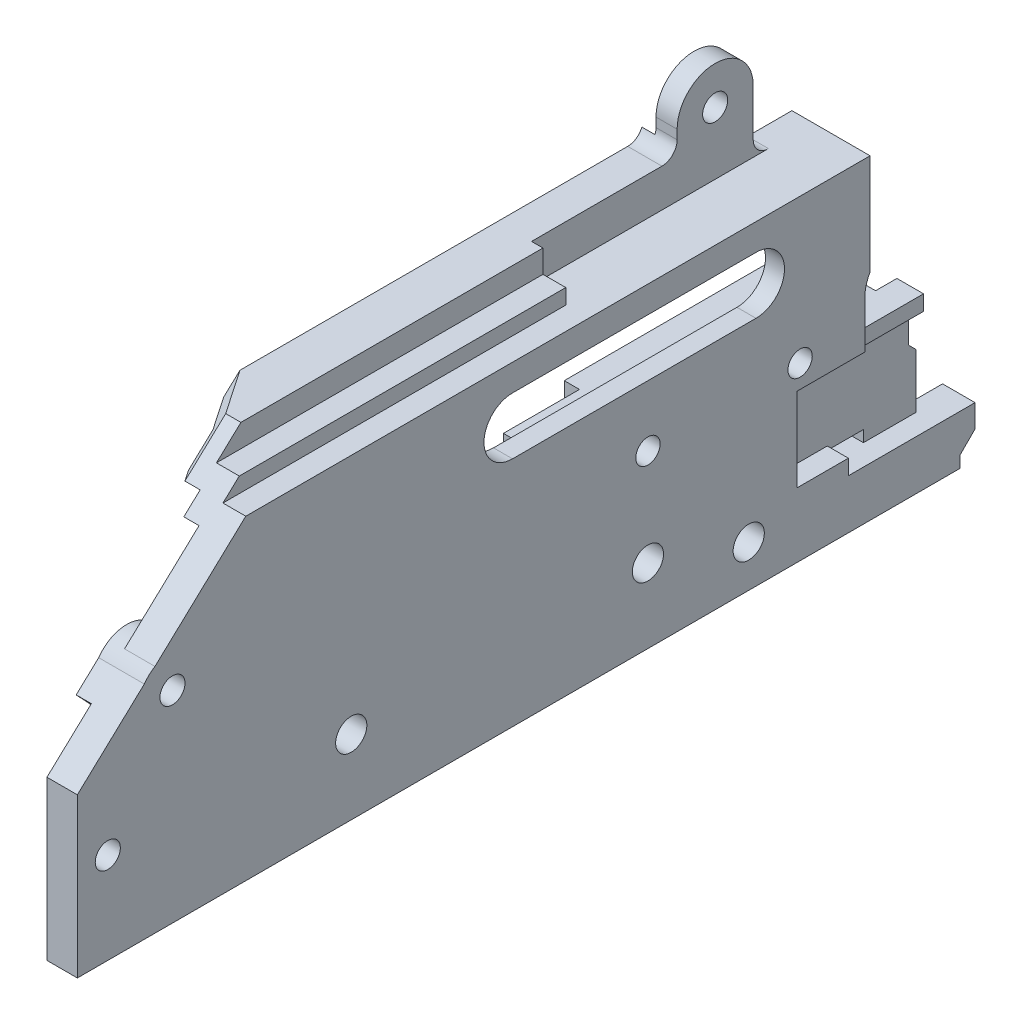
from build123d import *
from build123d.topology import SkipClean

# Parameters (mm, degrees)
SKETCH_1_W                       = 33.2
SKETCH_1_H                       = 22
SKETCH_1_R                       = 1.6
EXTRUDE_1_DEPTH                  = 7
SKETCH_2_W                       = 33.2
SKETCH_2_H                       = 10.5
EXTRUDE_2_DEPTH                  = 2
EXTRUDE_3_DEPTH                  = 60
SKETCH_4_W                       = 2
SKETCH_4_H                       = 10.5
EXTRUDE_4_DEPTH                  = 38.5
SKETCH_5_W                       = 4
SKETCH_5_H                       = 10.5
EXTRUDE_5_DEPTH                  = 2
SKETCH_6_W                       = 4
SKETCH_6_H                       = 10.5
EXTRUDE_6_DEPTH                  = 19.5
SKETCH_7_W                       = 6
SKETCH_7_H                       = 93.2
EXTRUDE_7_DEPTH                  = 2
SKETCH_8_W                       = 93.2
SKETCH_8_H                       = 5
EXTRUDE_8_DEPTH                  = 3
SKETCH_10_W                      = 93.2
SKETCH_10_H                      = 2
EXTRUDE_9_DEPTH                  = 5.5
SKETCH_12_W                      = 18
SKETCH_12_H                      = 2
CUT_EXTRUDE_1_DEPTH              = 5.5
SKETCH_13_W                      = 40
SKETCH_13_H                      = 5
EXTRUDE_10_DEPTH                 = 3.5
CUT_EXTRUDE_2_REACH              = 70.879
SKETCH_15_W                      = 15.5
SKETCH_15_H                      = 5
SKETCH_16_W                      = 3.5
SKETCH_16_H                      = 2.5
EXTRUDE_12_DEPTH                 = 2
CUT_EXTRUDE_3_REACH              = 71.313
CHAMFER_1_SIZE                   = 3.5
SKETCH_18_R                      = 1.65
EXTRUDE_13_DEPTH                 = 2
FILLET_1_R                       = 2
SKETCH_19_W                      = 4.5
SKETCH_19_H                      = 21.5
CUT_EXTRUDE_4_DEPTH              = 5
CHAMFER_2_SIZE                   = 3
CUT_EXTRUDE_5_REACH              = 74.561
SKETCH_20_R                      = 1.65
EXTRUDE_14_REACH                 = 73.895
SKETCH_21_R                      = 4.5
SKETCH_21_R_2                    = 1.65
EXTRUDE_15_DEPTH                 = 6
EXTRUDE_16_DEPTH                 = 4
CUT_EXTRUDE_6_REACH              = 83.84
SKETCH_24_R                      = 1.65
CUT_EXTRUDE_7_REACH              = 84.171
SKETCH_26_W                      = 2
SKETCH_26_H                      = 10.5
CUT_EXTRUDE_8_DEPTH              = 5
SKETCH_27_W                      = 2
SKETCH_27_H                      = 2
EXTRUDE_17_DEPTH                 = 10
CUT_EXTRUDE_9_DEPTH              = 2
CUT_EXTRUDE_10_REACH             = 84.426
SKETCH_29_R                      = 5.5
SKETCH_30_W                      = 63
SKETCH_30_H                      = 2
EXTRUDE_18_DEPTH                 = 1
SKETCH_32_R                      = 1.65
EXTRUDE_19_DEPTH                 = 0.775
EXTRUDE_20_DEPTH                 = 5.5
SKETCH_35_W                      = 5
SKETCH_35_H                      = 10
CUT_EXTRUDE_12_DEPTH             = 1.225
SKETCH_36_W                      = 4
SKETCH_36_H                      = 10
EXTRUDE_21_DEPTH                 = 5
CUT_EXTRUDE_13_REACH             = 84.197
SKETCH_37_W                      = 4.75
SKETCH_37_H                      = 3
CUT_EXTRUDE_13_DIRECTION_2_REACH = 84.197
CUT_EXTRUDE_14_REACH             = 84.197
SKETCH_38_W                      = 14.6
SKETCH_38_H                      = 11
CUT_EXTRUDE_14_DIRECTION_2_DEPTH = 1
SKETCH_39_W                      = 1.5
SKETCH_39_H                      = 20
EXTRUDE_22_DEPTH                 = 5.8
EXTRUDE_22_DIRECTION_2_REACH     = 116.063
SKETCH_40_W                      = 1.5
SKETCH_40_H                      = 10
EXTRUDE_23_DEPTH                 = 5
CUT_EXTRUDE_15_REACH             = 84.085
SKETCH_41_W                      = 1
SKETCH_41_H                      = 7
CHAMFER_3_SIZE                   = 1
SKETCH_42_W                      = 2.775
SKETCH_42_H                      = 5
EXTRUDE_24_DEPTH                 = 10.8
CUT_EXTRUDE_16_REACH             = 84.085
SKETCH_43_W                      = 0.6
SKETCH_43_H                      = 2
SKETCH_44_W                      = 9.8
SKETCH_44_H                      = 2
EXTRUDE_25_DEPTH                 = 2
SKETCH_45_W                      = 0.8
SKETCH_45_H                      = 6.1
CUT_EXTRUDE_17_DEPTH             = 0.775
CUT_EXTRUDE_18_REACH             = 84.426
SKETCH_46_R                      = 2.05
CUT_EXTRUDE_19_DEPTH             = 1
SKETCH_48_R                      = 2.05
CUT_EXTRUDE_20_DEPTH             = 5
CUT_EXTRUDE_21_REACH             = 113.959
SKETCH_50_W                      = 0.5
SKETCH_50_H                      = 17.5
CUT_EXTRUDE_22_DEPTH             = 3
EXTRUDE_26_DEPTH                 = 14.5
EXTRUDE_27_DEPTH                 = 0.5
SKETCH_54_W                      = 28.68337521
SKETCH_54_H                      = 12.5
SKETCH_54_W_2                    = 11.341687605
CUT_EXTRUDE_23_DEPTH             = 3
EXTRUDE_28_REACH                 = 83.879
FILLET_2_R                       = 0.8
EXTRUDE_START                    = -3.5
SKETCH_56_R                      = 4
SKETCH_56_R_2                    = 2.05
EXTRUDE_29_DEPTH                 = 3.5
FILLET_3_R                       = 0.8
CUT_EXTRUDE_24_REACH             = 83.879
SKETCH_57_R                      = 2.05
SKETCH_58_W                      = 15.2
SKETCH_58_H                      = 8.5
CUT_EXTRUDE_25_DEPTH             = 3.5
FILLET_4_R                       = 0.8
EXTRUDE_START_2                  = 0.5
SKETCH_31_W                      = 76.7
SKETCH_31_H                      = 10.5
EXTRUDE_30_DEPTH                 = 0.5
CUT_EXTRUDE_26_REACH             = 83.939
SKETCH_59_W                      = 2.6
SKETCH_59_H                      = 10
CUT_EXTRUDE_27_REACH             = 83.939
EXTRUDE_31_DEPTH                 = 1.5
SKETCH_62_W                      = 2.775
SKETCH_62_H                      = 2
EXTRUDE_32_DEPTH                 = 1.5
EXTRUDE_33_DEPTH                 = 1.5
SKETCH_64_W                      = 4.275
SKETCH_64_H                      = 5
EXTRUDE_34_DEPTH                 = 5
CHAMFER_4_SIZE                   = 2
EXTRUDE_START_3                  = 1.5
SKETCH_65_R                      = 2.05
EXTRUDE_35_DEPTH                 = 1.5
CUT_EXTRUDE_28_DEPTH             = 1
SKETCH_67_W                      = 1.5
SKETCH_67_H                      = 1.5
EXTRUDE_36_DEPTH                 = 1.5
CUT_EXTRUDE_29_REACH             = 76.844
EXTRUDE_37_REACH                 = 74.163
CUT_EXTRUDE_30_DEPTH             = 10
EXTRUDE_38_DEPTH                 = 0.5
CUT_EXTRUDE_31_DEPTH             = 2.932558371


# Some blends are built 0.0001 mm under size
with BuildPart() as part:
    # 草图1 → 凸台-拉伸1 (new body)
    with BuildSketch(Plane(origin=(0, 0, 0), x_dir=(0, 0, -1), z_dir=(1, 0, 0))):
        with Locations((12.6, -4.5)):
            Rectangle(SKETCH_1_W, SKETCH_1_H)
        Circle(SKETCH_1_R, mode=Mode.SUBTRACT)
        with Locations((20, 0)):
            Circle(SKETCH_1_R, mode=Mode.SUBTRACT)
    extrude(amount=EXTRUDE_1_DEPTH)

    # 草图2 → 凸台-拉伸2 (add)
    with BuildSketch(Plane(origin=(7, 0, 0), x_dir=(0, 0, -1), z_dir=(1, 0, 0))):
        with Locations((12.6, 11.75)):
            Rectangle(SKETCH_2_W, SKETCH_2_H)
    extrude(amount=-EXTRUDE_2_DEPTH)

    # 草图3 → 凸台-拉伸3 (add)
    with BuildSketch(Plane.XY.offset(4)):
        Polygon((7, -15.5), (1, -15.5), (1, 4.5), (3, 4.5), (3, 6.5), (7, 6.5), align=None)
    extrude(amount=EXTRUDE_3_DEPTH)

    # 草图4 → 凸台-拉伸4 (add)
    with BuildSketch(Plane.XY.offset(4)):
        with Locations((6, 11.75)):
            Rectangle(SKETCH_4_W, SKETCH_4_H)
    extrude(amount=EXTRUDE_4_DEPTH)

    # 草图5 → 凸台-拉伸5 (add)
    with BuildSketch(Plane.XY.offset(42.5)):
        with Locations((5, 11.75)):
            Rectangle(SKETCH_5_W, SKETCH_5_H)
    extrude(amount=EXTRUDE_5_DEPTH)

    # 草图6 → 凸台-拉伸6 (add)
    with BuildSketch(Plane.XY.offset(44.5)):
        with Locations((5, 11.75)):
            Rectangle(SKETCH_6_W, SKETCH_6_H)
    extrude(amount=EXTRUDE_6_DEPTH)

    # 草图7 → 凸台-拉伸7 (add)
    with BuildSketch(Plane(origin=(0, 17, 0), x_dir=(1, 0, 0), z_dir=(0, 1, 0))):
        with Locations((4, -17.4)):
            Rectangle(SKETCH_7_W, SKETCH_7_H)
    extrude(amount=EXTRUDE_7_DEPTH)

    # 草图8 → 凸台-拉伸8 (add)
    with BuildSketch(Plane.ZY.offset(-1)):
        with Locations((17.4, 21.5)):
            Rectangle(SKETCH_8_W, SKETCH_8_H)
    extrude(amount=-EXTRUDE_8_DEPTH)

    # 草图10 → 凸台-拉伸9 (add)
    with BuildSketch(Plane.ZY.offset(-1)):
        with Locations((17.4, 23)):
            Rectangle(SKETCH_10_W, SKETCH_10_H)
    extrude(amount=EXTRUDE_9_DEPTH)

    # 草图12 → 切除-拉伸1 (cut)
    with BuildSketch(Plane.ZY.offset(4.5)):
        with Locations((-20.2, 23)):
            Rectangle(SKETCH_12_W, SKETCH_12_H)
    extrude(amount=-CUT_EXTRUDE_1_DEPTH, mode=Mode.SUBTRACT)

    # 草图13 → 凸台-拉伸10 (add)
    with BuildSketch(Plane.ZY.offset(-1)):
        with Locations((-9.2, 19.5)):
            Rectangle(SKETCH_13_W, SKETCH_13_H)
    extrude(amount=EXTRUDE_10_DEPTH)

    # 草图15 → 切除-拉伸2 (cut, up to next)
    with BuildSketch(Plane(origin=(4, 0, 0), x_dir=(0, 0, -1), z_dir=(1, 0, 0)), mode=Mode.PRIVATE) as cut_extrude_2_sk1:
        with Locations((21.45, 21.5)):
            Rectangle(SKETCH_15_W, SKETCH_15_H)
    cut_extrude_2_tool1 = extrude(cut_extrude_2_sk1.sketch, amount=-CUT_EXTRUDE_2_REACH, mode=Mode.PRIVATE) & part.part
    add(cut_extrude_2_tool1.solids().sort_by_distance((4, 21.5, -21.45))[0], mode=Mode.SUBTRACT)

    # 草图16 → 凸台-拉伸12 (add)
    with BuildSketch(Plane(origin=(0, 22, 0), x_dir=(1, 0, 0), z_dir=(0, 1, 0))):
        with Locations((-0.75, 12.45)):
            Rectangle(SKETCH_16_W, SKETCH_16_H)
    extrude(amount=EXTRUDE_12_DEPTH)

    # 草图17 → 切除-拉伸3 (cut, up to next)
    with BuildSketch(Plane(origin=(7, 0, 0), x_dir=(0, 0, -1), z_dir=(1, 0, 0)), mode=Mode.PRIVATE) as cut_extrude_3_sk1:
        Polygon((-47.5, 24), (-64, 8.613501079), (-64, 24), align=None)
    cut_extrude_3_tool1 = extrude(cut_extrude_3_sk1.sketch, amount=-CUT_EXTRUDE_3_REACH, mode=Mode.PRIVATE) & part.part
    add(cut_extrude_3_tool1.solids().sort_by_distance((7, 18.871167, 58.5))[0], mode=Mode.SUBTRACT)

    # 倒角1
    # the kernel refuses this chamfer: 3.5 mm, written as the material it takes off along each edge
    with BuildSketch(Plane(origin=(-4.5, 15.861407469, 56.227571974), x_dir=(0.9996219169112969, 0.020109211138415985, 0.018752142756900524), z_dir=(0, 0.6819983600625026, -0.7313537016191667))) as chamfer_1_piece_1:
        Polygon((CHAMFER_1_SIZE * 0.999621916911, CHAMFER_1_SIZE * 0.0274958766106), (-CHAMFER_1_SIZE * 0.0274958766106, CHAMFER_1_SIZE * 0.999621916911), (0, 0), align=None)
    extrude(amount=20.934339287, mode=Mode.SUBTRACT)

    # 草图18 → 凸台-拉伸13 (add)
    with BuildSketch(Plane.ZY.offset(2.5)):
        with BuildLine():
            Line((-11.337, 27.2), (-11.337, 24))
            Line((-11.337, 24), (-13.7, 24))
            Line((-13.7, 24), (-13.7, 19))
            Line((-13.7, 19), (-21.337, 19))
            Line((-21.337, 19), (-21.337, 27.2))
            ThreePointArc((-21.337, 27.2), (-16.337, 32.2), (-11.337, 27.2))
        make_face()
        with Locations((-16.337, 27.2)):
            Circle(SKETCH_18_R, mode=Mode.SUBTRACT)
    extrude(amount=-EXTRUDE_13_DEPTH)

    # 圆角1
    fillet_1_edges = [part.edges().sort_by_distance(p)[0] for p in [
        (-1.5, 24, -11.337),
        (-1.5, 19, -21.337),
    ]]
    fillet(fillet_1_edges, radius=FILLET_1_R)

    # 草图19 → 切除-拉伸4 (cut)
    with BuildSketch(Plane(origin=(0, 24, 0), x_dir=(1, 0, 0), z_dir=(0, 1, 0))):
        with Locations((1.75, 2.95)):
            Rectangle(SKETCH_19_W, SKETCH_19_H)
    extrude(amount=-CUT_EXTRUDE_4_DEPTH, mode=Mode.SUBTRACT)

    # 倒角2
    chamfer_2_edges = [part.edges().sort_by_distance(p)[0] for p in [
        (4, 24, 27.65),
        (1, 22, 30.22236871),
    ]]
    chamfer(chamfer_2_edges, length=CHAMFER_2_SIZE)

    # 草图20 → 切除-拉伸5 (cut, up to next)
    with BuildSketch(Plane(origin=(7, 0, 0), x_dir=(0, 0, -1), z_dir=(1, 0, 0)), mode=Mode.PRIVATE) as cut_extrude_5_sk1:
        with Locations((-62.5, 4)):
            Circle(SKETCH_20_R)
    cut_extrude_5_tool1 = extrude(cut_extrude_5_sk1.sketch, amount=-CUT_EXTRUDE_5_REACH, mode=Mode.PRIVATE) & part.part
    add(cut_extrude_5_tool1.solids().sort_by_distance((7, 4, 62.5))[0], mode=Mode.SUBTRACT)

    # 凸台-拉伸14: up to this face of the body (flat: up to its plane)
    extrude_14_end = Plane(part.part.faces().sort_by_distance((7, 1.498387626, 16.627822956))[0])
    # 草图21 → 凸台-拉伸14 (add, up to the picked face)
    with BuildSketch(Plane.ZY.offset(-1), mode=Mode.PRIVATE) as extrude_14_sk1:
        with Locations((62.5, 4)):
            Circle(SKETCH_21_R)
        with Locations(Location((62.5, 4, 0), (0, 0, 180))):
            Circle(SKETCH_21_R_2, mode=Mode.SUBTRACT)
    extrude_14_tool1 = split(extrude(extrude_14_sk1.sketch, amount=-EXTRUDE_14_REACH, mode=Mode.PRIVATE), bisect_by=extrude_14_end, keep=Keep.BOTH, mode=Mode.PRIVATE)
    add(extrude_14_tool1.solids().sort_by(Axis((1, 4, 58.127279), (1, 0, 0)))[0])

    # 草图22 → 凸台-拉伸15 (add)
    with BuildSketch(Plane.ZY.offset(-1)):
        with BuildLine():
            Line((66.198595209, 6.563277878), (75, -1.644164869))
            Line((75, -1.644164869), (75, -15.5))
            Line((75, -15.5), (64, -15.5))
            Line((64, -15.5), (64, -0.242640687))
            ThreePointArc((64, -0.242640687), (66.782111619, 2.616699568), (66.198595209, 6.563277878))
        make_face()
    extrude(amount=-EXTRUDE_15_DEPTH)

    # 草图23 → 凸台-拉伸16 (add)
    with BuildSketch(Plane(origin=(7, 0, 0), x_dir=(0, 0, -1), z_dir=(1, 0, 0))):
        Polygon((-64, 8.613501079), (-64.799032902, 7.868390843), (-64, 8.242640687), align=None)
    extrude(amount=-EXTRUDE_16_DEPTH)

    # 草图24 → 切除-拉伸6 (cut, up to next)
    with BuildSketch(Plane.ZY.offset(-1), mode=Mode.PRIVATE) as cut_extrude_6_sk1:
        with Locations(Location((71, -10.5, 0), (0, 0, 270))):
            Circle(SKETCH_24_R)
    cut_extrude_6_tool1 = extrude(cut_extrude_6_sk1.sketch, amount=-CUT_EXTRUDE_6_REACH, mode=Mode.PRIVATE) & part.part
    add(cut_extrude_6_tool1.solids().sort_by_distance((1, -10.5, 71))[0], mode=Mode.SUBTRACT)

    # 草图25 → 切除-拉伸7 (cut, up to next)
    with BuildSketch(Plane.ZY.offset(-5), mode=Mode.PRIVATE) as cut_extrude_7_sk1:
        with BuildLine():
            Line((17.8, 8), (-14.2, 8))
            ThreePointArc((-14.2, 8), (-17.95, 11.75), (-14.2, 15.5))
            Line((-14.2, 15.5), (17.8, 15.5))
            ThreePointArc((17.8, 15.5), (21.55, 11.75), (17.8, 8))
        make_face()
    cut_extrude_7_tool1 = extrude(cut_extrude_7_sk1.sketch, amount=-CUT_EXTRUDE_7_REACH, mode=Mode.PRIVATE) & part.part
    add(cut_extrude_7_tool1.solids().sort_by_distance((5, 11.75, 1.8))[0], mode=Mode.SUBTRACT)

    # 草图26 → 切除-拉伸8 (cut)
    with BuildSketch(Plane(origin=(0, 0, 42.5), x_dir=(-1, 0, 0), z_dir=(0, 0, -1))):
        with Locations((-4, 11.75)):
            Rectangle(SKETCH_26_W, SKETCH_26_H)
    extrude(amount=-CUT_EXTRUDE_8_DEPTH, mode=Mode.SUBTRACT)

    # 草图27 → 凸台-拉伸17 (add)
    with BuildSketch(Plane.XY.offset(4)):
        with Locations((2, 5.5)):
            Rectangle(SKETCH_27_W, SKETCH_27_H)
    extrude(amount=EXTRUDE_17_DEPTH)

    # 草图28 → 切除-拉伸9 (cut)
    with BuildSketch(Plane.ZY.offset(-1)):
        Polygon((67, 1.494263267), (67, -15.5), (75, -15.5), (75, -1.644164869), (69.155582564, 3.80584256), align=None)
    extrude(amount=-CUT_EXTRUDE_9_DEPTH, mode=Mode.SUBTRACT)

    # 草图29 → 切除-拉伸10 (cut, up to next)
    with BuildSketch(Plane(origin=(7, 0, 0), x_dir=(0, 0, -1), z_dir=(1, 0, 0)), mode=Mode.PRIVATE) as cut_extrude_10_sk1:
        with Locations((34, 3.1)):
            Circle(SKETCH_29_R)
    cut_extrude_10_tool1 = extrude(cut_extrude_10_sk1.sketch, amount=-CUT_EXTRUDE_10_REACH, mode=Mode.PRIVATE) & part.part
    add(cut_extrude_10_tool1.solids().sort_by_distance((7, 3.1, -34))[0], mode=Mode.SUBTRACT)

    # 草图30 → 凸台-拉伸18 (add)
    with BuildSketch(Plane.ZY.offset(-1)):
        with Locations((35.5, -5.5)):
            Rectangle(SKETCH_30_W, SKETCH_30_H)
    extrude(amount=EXTRUDE_18_DEPTH)

    # 草图32 → 凸台-拉伸19 (add)
    with BuildSketch(Plane.ZY.offset(2.5)):
        with BuildLine():
            Line((-11.2, 22), (-11.2, 25.272517354))
            ThreePointArc((-11.2, 25.272517354), (-11.302451602, 25.62986489), (-11.337, 26))
            Line((-11.337, 26), (-11.337, 27.2))
            ThreePointArc((-11.337, 27.2), (-16.337, 32.2), (-21.337, 27.2))
            Line((-21.337, 27.2), (-21.337, 21))
            ThreePointArc((-21.337, 21), (-21.922786438, 19.585786438), (-23.337, 19))
            Line((-23.337, 19), (-29.2, 19))
            Line((-29.2, 19), (-29.2, 17))
            Line((-29.2, 17), (10.8, 17))
            Line((10.8, 17), (10.8, 22))
            Line((10.8, 22), (-11.2, 22))
        make_face()
        with Locations((-16.337, 27.2)):
            Circle(SKETCH_32_R, mode=Mode.SUBTRACT)
    extrude(amount=EXTRUDE_19_DEPTH)

    # 草图34 → 凸台-拉伸20 (add)
    with BuildSketch(Plane.XZ.offset(15.5)):
        Polygon((3, 75), (3, 67), (1, 67), (1, 4), (0, 4), (0, -29.2), (7, -29.2), (7, 75), align=None)
    extrude(amount=EXTRUDE_20_DEPTH)

    # 草图35 → 切除-拉伸12 (cut)
    with BuildSketch(Plane.ZY):
        with Locations((-26.7, -16)):
            Rectangle(SKETCH_35_W, SKETCH_35_H)
    extrude(amount=-CUT_EXTRUDE_12_DEPTH, mode=Mode.SUBTRACT)

    # 草图36 → 凸台-拉伸21 (add)
    with BuildSketch(Plane(origin=(0, 0, -29.2), x_dir=(-1, 0, 0), z_dir=(0, 0, -1))):
        with Locations((-3.225, -16)):
            Rectangle(SKETCH_36_W, SKETCH_36_H)
    extrude(amount=EXTRUDE_21_DEPTH)

    # 草图37 → 切除-拉伸13 (cut, up to next)
    with BuildSketch(Plane(origin=(5.225, 0, 0), x_dir=(0, 0, -1), z_dir=(1, 0, 0)), mode=Mode.PRIVATE) as cut_extrude_13_sk1:
        with Locations((31.225, -14.5)):
            Rectangle(SKETCH_37_W, SKETCH_37_H)
    cut_extrude_13_tool1 = extrude(cut_extrude_13_sk1.sketch, amount=-CUT_EXTRUDE_13_REACH, mode=Mode.PRIVATE) & part.part
    add(cut_extrude_13_tool1.solids().sort_by_distance((5.225, -14.5, -31.225))[0], mode=Mode.SUBTRACT)

    # 草图37 → 切除-拉伸13 direction 2 (cut, up to next)
    with BuildSketch(Plane(origin=(5.225, 0, 0), x_dir=(0, 0, -1), z_dir=(1, 0, 0)), mode=Mode.PRIVATE) as cut_extrude_13_direction_2_sk1:
        with Locations((31.225, -14.5)):
            Rectangle(SKETCH_37_W, SKETCH_37_H)
    cut_extrude_13_direction_2_tool1 = extrude(cut_extrude_13_direction_2_sk1.sketch, amount=CUT_EXTRUDE_13_DIRECTION_2_REACH, mode=Mode.PRIVATE) & part.part
    add(cut_extrude_13_direction_2_tool1.solids().sort_by_distance((5.225, -14.5, -31.225))[0], mode=Mode.SUBTRACT)

    # 草图38 → 切除-拉伸14 (cut, up to next)
    with BuildSketch(Plane(origin=(5.225, 0, 0), x_dir=(0, 0, -1), z_dir=(1, 0, 0)), mode=Mode.PRIVATE) as cut_extrude_14_sk1:
        with Locations((26.9, -8.5)):
            Rectangle(SKETCH_38_W, SKETCH_38_H)
    cut_extrude_14_tool1 = extrude(cut_extrude_14_sk1.sketch, amount=CUT_EXTRUDE_14_REACH, mode=Mode.PRIVATE) & part.part
    add(cut_extrude_14_tool1.solids().sort_by_distance((5.225, -8.5, -26.9))[0], mode=Mode.SUBTRACT)

    # 草图38 → 切除-拉伸14 direction 2 (cut)
    with BuildSketch(Plane(origin=(5.225, 0, 0), x_dir=(0, 0, -1), z_dir=(1, 0, 0))):
        with Locations((26.9, -8.5)):
            Rectangle(SKETCH_38_W, SKETCH_38_H)
    extrude(amount=-CUT_EXTRUDE_14_DIRECTION_2_DEPTH, mode=Mode.SUBTRACT)

    # 草图39 → 凸台-拉伸22 (add)
    with BuildSketch(Plane(origin=(0, 0, -34.2), x_dir=(-1, 0, 0), z_dir=(0, 0, -1))):
        with Locations((-3.475, -11)):
            Rectangle(SKETCH_39_W, SKETCH_39_H)
    extrude(amount=EXTRUDE_22_DEPTH)

    # 草图39 → 凸台-拉伸22 direction 2 (add, up to next)
    with BuildSketch(Plane(origin=(0, 0, -34.2), x_dir=(-1, 0, 0), z_dir=(0, 0, -1)), mode=Mode.PRIVATE) as extrude_22_direction_2_sk1:
        with Locations((-3.475, -11)):
            Rectangle(SKETCH_39_W, SKETCH_39_H)
    extrude_22_direction_2_tool1 = extrude(extrude_22_direction_2_sk1.sketch, amount=-EXTRUDE_22_DIRECTION_2_REACH, mode=Mode.PRIVATE) - part.part
    add(extrude_22_direction_2_tool1.solids().sort_by_distance((3.475, -11, -34.2))[0])

    # 草图40 → 凸台-拉伸23 (add)
    with BuildSketch(Plane(origin=(0, 0, -29.2), x_dir=(-1, 0, 0), z_dir=(0, 0, -1))):
        with Locations((-1.975, -6)):
            Rectangle(SKETCH_40_W, SKETCH_40_H)
    extrude(amount=EXTRUDE_23_DEPTH)

    # 草图41 → 切除-拉伸15 (cut, up to next)
    with BuildSketch(Plane(origin=(4.225, 0, 0), x_dir=(0, 0, -1), z_dir=(1, 0, 0)), mode=Mode.PRIVATE) as cut_extrude_15_sk1:
        with Locations((39.5, -4.5)):
            Rectangle(SKETCH_41_W, SKETCH_41_H)
    cut_extrude_15_tool1 = extrude(cut_extrude_15_sk1.sketch, amount=-CUT_EXTRUDE_15_REACH, mode=Mode.PRIVATE) & part.part
    add(cut_extrude_15_tool1.solids().sort_by_distance((4.225, -4.5, -39.5))[0], mode=Mode.SUBTRACT)

    # 倒角3
    chamfer_3_edges = [part.edges().sort_by_distance(p)[0] for p in [
        (3.475, -8, -39),
    ]]
    chamfer(chamfer_3_edges, length=CHAMFER_3_SIZE - 0.0001)  # a hair under: the kernel refuses the full size

    # 草图42 → 凸台-拉伸24 (add)
    with BuildSketch(Plane(origin=(0, 0, -29.2), x_dir=(-1, 0, 0), z_dir=(0, 0, -1))):
        with Locations((-5.6125, -18.5)):
            Rectangle(SKETCH_42_W, SKETCH_42_H)
    extrude(amount=EXTRUDE_24_DEPTH)

    # 草图43 → 切除-拉伸16 (cut, up to next)
    with BuildSketch(Plane(origin=(4.225, 0, 0), x_dir=(0, 0, -1), z_dir=(1, 0, 0)), mode=Mode.PRIVATE) as cut_extrude_16_sk1:
        with Locations((33.9, -15)):
            Rectangle(SKETCH_43_W, SKETCH_43_H)
    cut_extrude_16_tool1 = extrude(cut_extrude_16_sk1.sketch, amount=CUT_EXTRUDE_16_REACH, mode=Mode.PRIVATE) & part.part
    add(cut_extrude_16_tool1.solids().sort_by_distance((4.225, -15, -33.9))[0], mode=Mode.SUBTRACT)

    # 草图44 → 凸台-拉伸25 (add)
    with BuildSketch(Plane(origin=(4.225, 0, 0), x_dir=(0, 0, -1), z_dir=(1, 0, 0))):
        with Locations((34.1, -2)):
            Rectangle(SKETCH_44_W, SKETCH_44_H)
    extrude(amount=EXTRUDE_25_DEPTH)

    # 草图45 → 切除-拉伸17 (cut)
    with BuildSketch(Plane(origin=(7, 0, 0), x_dir=(0, 0, -1), z_dir=(1, 0, 0))):
        with Locations((28.9, 0.05)):
            Rectangle(SKETCH_45_W, SKETCH_45_H)
    extrude(amount=-CUT_EXTRUDE_17_DEPTH, mode=Mode.SUBTRACT)

    # 草图46 → 切除-拉伸18 (cut, up to next)
    with BuildSketch(Plane(origin=(7, 0, 0), x_dir=(0, 0, -1), z_dir=(1, 0, 0)), mode=Mode.PRIVATE) as cut_extrude_18_sk1:
        with Locations((13.25, -17)):
            Circle(SKETCH_46_R)
    cut_extrude_18_tool1 = extrude(cut_extrude_18_sk1.sketch, amount=-CUT_EXTRUDE_18_REACH, mode=Mode.PRIVATE) & part.part
    add(cut_extrude_18_tool1.solids().sort_by_distance((7, -17, -13.25))[0], mode=Mode.SUBTRACT)

    # 草图47 → 切除-拉伸19 (cut)
    with BuildSketch(Plane.ZY.offset(-1)):
        with BuildLine():
            Line((62.5, -0.5), (67, -0.5))
            Line((67, -0.5), (67, -4.5))
            Line((67, -4.5), (4, -4.5))
            Line((4, -4.5), (4, 6.5))
            Line((4, 6.5), (14, 6.5))
            Line((14, 6.5), (14, 4.5))
            Line((14, 4.5), (58.027864045, 4.5))
            ThreePointArc((58.027864045, 4.5), (59.145898034, 1), (62.5, -0.5))
        make_face()
    extrude(amount=-CUT_EXTRUDE_19_DEPTH, mode=Mode.SUBTRACT)

    # 草图48 → 切除-拉伸20 (cut)
    with BuildSketch(Plane.XZ.offset(21)):
        with Locations(Location((3.5, 58, 0), (0, 0, 270))):
            Circle(SKETCH_48_R)
        with Locations(Location((3.5, 20, 0), (0, 0, 270))):
            Circle(SKETCH_48_R)
        with Locations(Location((3.5, -18, 0), (0, 0, 270))):
            Circle(SKETCH_48_R)
    extrude(amount=-CUT_EXTRUDE_20_DEPTH, mode=Mode.SUBTRACT)

    # 草图50 → 切除-拉伸21 (cut, up to next)
    with BuildSketch(Plane.XY.offset(67), mode=Mode.PRIVATE) as cut_extrude_21_sk1:
        with Locations((0.25, -12.25)):
            Rectangle(SKETCH_50_W, SKETCH_50_H)
    cut_extrude_21_tool1 = extrude(cut_extrude_21_sk1.sketch, amount=-CUT_EXTRUDE_21_REACH, mode=Mode.PRIVATE) & part.part
    add(cut_extrude_21_tool1.solids().sort_by_distance((0.25, -12.25, 67))[0], mode=Mode.SUBTRACT)

    # 草图51 → 切除-拉伸22 (cut)
    with BuildSketch(Plane(origin=(0, 0, -28.85), x_dir=(-1, 0, 0), z_dir=(0, 0, -1))):
        Polygon((-4.225, -14), (-7, -14), (-7, -16), (-1.225, -16), (-1.225, -13), (-4.225, -13), align=None)
    extrude(amount=-CUT_EXTRUDE_22_DEPTH, mode=Mode.SUBTRACT)

    # 草图52 → 凸台-拉伸26 (add)
    with BuildSketch(Plane.XZ.offset(21)):
        with BuildLine():
            Line((1, 59.658312395), (1, 56.341687605))
            ThreePointArc((1, 56.341687605), (0.5, 58), (1, 59.658312395))
        make_face()
        with BuildLine():
            Line((1, 21.658312395), (1, 18.341687605))
            ThreePointArc((1, 18.341687605), (0.5, 20), (1, 21.658312395))
        make_face()
    extrude(amount=-EXTRUDE_26_DEPTH)

    # 草图53 → 凸台-拉伸27 (add)
    with BuildSketch(Plane.ZY.offset(-1)):
        Polygon((4, -21), (4, -19), (18.341687605, -19), (18.341687605, -6.5), (21.658312395, -6.5), (21.658312395, -19), (56.341687605, -19), (56.341687605, -6.5), (59.658312395, -6.5), (59.658312395, -19), (66, -19), (66, -6.5), (67, -6.5), (67, -19), (67, -21), align=None)
    extrude(amount=EXTRUDE_27_DEPTH)

    # 草图54 → 切除-拉伸23 (cut)
    with BuildSketch(Plane.ZY.offset(-1)):
        with Locations((39, -12.75)):
            Rectangle(SKETCH_54_W, SKETCH_54_H)
        with Locations((9.670843803, -12.75)):
            Rectangle(SKETCH_54_W_2, SKETCH_54_H)
    extrude(amount=-CUT_EXTRUDE_23_DEPTH, mode=Mode.SUBTRACT)

    # 草图55 → 凸台-拉伸28 (add, up to next)
    with BuildSketch(Plane.ZY.offset(-0.5), mode=Mode.PRIVATE) as extrude_28_sk1:
        Polygon((4, -18.336739034), (17.580705079, -6.5), (18.341687605, -6.5), (18.341687605, -7.163260966), (4.760982526, -19), (4, -19), align=None)
    extrude_28_tool1 = extrude(extrude_28_sk1.sketch, amount=-EXTRUDE_28_REACH, mode=Mode.PRIVATE) - part.part
    # 草图55 → 凸台-拉伸28 (add, up to next)
    with BuildSketch(Plane.ZY.offset(-0.5), mode=Mode.PRIVATE) as extrude_28_sk2:
        Polygon((23.132998269, -6.5), (39, -12.218518467), (54.867001731, -6.5), (56.341687605, -6.5), (56.341687605, -7.031481533), (40.474685873, -12.75), (56.341687605, -18.468518467), (56.341687605, -19), (54.867001731, -19), (39, -13.281481533), (23.132998269, -19), (21.658312395, -19), (21.658312395, -18.468518467), (37.525314127, -12.75), (21.658312395, -7.031481533), (21.658312395, -6.5), align=None)
    extrude_28_tool2 = extrude(extrude_28_sk2.sketch, amount=-EXTRUDE_28_REACH, mode=Mode.PRIVATE) - part.part
    # 草图55 → 凸台-拉伸28 (add, up to next)
    with BuildSketch(Plane.ZY.offset(-0.5), mode=Mode.PRIVATE) as extrude_28_sk3:
        Polygon((59.658312395, -7.605121348), (65.439333252, -19), (66, -19), (66, -17.894878652), (60.218979144, -6.5), (59.658312395, -6.5), align=None)
    extrude_28_tool3 = extrude(extrude_28_sk3.sketch, amount=-EXTRUDE_28_REACH, mode=Mode.PRIVATE) - part.part
    add(extrude_28_tool1.solids().sort_by_distance((0.5, -12.75, 11.170844))[0])
    add(extrude_28_tool2.solids().sort_by_distance((0.5, -12.75, 39))[0])
    add(extrude_28_tool3.solids().sort_by_distance((0.5, -12.75, 62.829156))[0])

    # 圆角2
    fillet_2_edges = [part.edges().sort_by_distance(p)[0] for p in [
        (0.75, -19, 18.341687605),
        (2.5, -19, 15.341687605),
        (2.5, -6.5, 15.341687605),
        (2.25, -6.5, 4),
        (0.75, -7.163260966, 18.341687605),
        (0.75, -6.5, 17.580705079),
        (2.5, -9.77801601, 15.341687605),
        (2.5, -8.451494077, 15.341687605),
        (2.25, -18.336739034, 4),
        (2.25, -19, 4.760982526),
        (2.25, -12.75, 37.525314127),
        (2.25, -13.281481533, 39),
        (2.25, -12.218518467, 39),
        (2.25, -12.75, 40.474685873),
        (2.5, -8.112691184, 53.341687605),
        (2.5, -17.387308816, 53.341687605),
        (0.75, -18.468518467, 56.341687605),
        (0.75, -7.031481533, 56.341687605),
        (0.75, -6.5, 54.867001731),
        (0.75, -19, 54.867001731),
        (0.75, -19, 23.132998269),
        (0.75, -6.5, 23.132998269),
        (0.75, -18.468518467, 21.658312395),
        (0.75, -7.031481533, 21.658312395),
        (0.75, -17.894878652, 66),
        (0.75, -19, 59.658312395),
        (0.75, -19, 65.439333252),
        (0.75, -6.5, 66),
        (0.75, -6.5, 60.218979144),
        (0.75, -7.605121348, 59.658312395),
    ]]
    fillet(fillet_2_edges, radius=FILLET_2_R)

    # 草图56 → 凸台-拉伸29 (add)
    with BuildSketch(Plane.ZY.offset(-0.5).offset(EXTRUDE_START)):
        with Locations((39, -12.75)):
            Circle(SKETCH_56_R)
        with Locations((39, -12.75)):
            Circle(SKETCH_56_R_2, mode=Mode.SUBTRACT)
    extrude(amount=EXTRUDE_29_DEPTH)

    # 圆角3
    fillet_3_edges = [part.edges().sort_by_distance(p)[0] for p in [
        (2.25, -14.565967072, 35.435976488),
        (2.25, -14.565967072, 42.564023512),
        (2.25, -10.934032928, 42.564023512),
        (2.25, -10.934032928, 35.435976488),
        (2.25, -11.874799388, 42.90307877),
        (2.25, -13.625200612, 42.90307877),
        (2.25, -13.625200612, 35.09692123),
        (2.25, -11.874799388, 35.09692123),
    ]]
    fillet(fillet_3_edges, radius=FILLET_3_R)

    # 草图57 → 切除-拉伸24 (cut, up to next)
    with BuildSketch(Plane.ZY.offset(-0.5), mode=Mode.PRIVATE) as cut_extrude_24_sk1:
        with Locations(Location((39, -12.75, 0), (0, 0, 270))):
            Circle(SKETCH_57_R)
    cut_extrude_24_tool1 = extrude(cut_extrude_24_sk1.sketch, amount=-CUT_EXTRUDE_24_REACH, mode=Mode.PRIVATE) & part.part
    # 草图57 → 切除-拉伸24 (cut, up to next)
    with BuildSketch(Plane.ZY.offset(-0.5), mode=Mode.PRIVATE) as cut_extrude_24_sk2:
        with Locations(Location((0, -12.75, 0), (0, 0, 270))):
            Circle(SKETCH_57_R)
    cut_extrude_24_tool2 = extrude(cut_extrude_24_sk2.sketch, amount=-CUT_EXTRUDE_24_REACH, mode=Mode.PRIVATE) & part.part
    add(cut_extrude_24_tool1.solids().sort_by_distance((0.5, -12.75, 39))[0], mode=Mode.SUBTRACT)
    add(cut_extrude_24_tool2.solids().sort_by_distance((0.5, -12.75, 0))[0], mode=Mode.SUBTRACT)

    # 草图58 → 切除-拉伸25 (cut)
    with SkipClean():  # the faces are left unmerged after this step: merging them gives an invalid solid
        with BuildSketch(Plane.ZY.offset(-0.5)):
            with Locations((-11.6, -8.75)):
                Rectangle(SKETCH_58_W, SKETCH_58_H)
        extrude(amount=-CUT_EXTRUDE_25_DEPTH, mode=Mode.SUBTRACT)

    # 圆角4
    fillet_4_edges = [part.edges().sort_by_distance(p)[0] for p in [
        (2.25, -13, -19.2),
        (2.25, -4.5, -19.2),
        (2.25, -4.5, -4),
        (2.25, -13, -4),
    ]]
    fillet(fillet_4_edges, radius=FILLET_4_R)

    # 草图31 → 凸台-拉伸30 (add)
    with SkipClean():  # the faces are left unmerged after this step: merging them gives an invalid solid
        with BuildSketch(Plane.ZY.offset(-5).offset(EXTRUDE_START_2)):
            with Locations((9.15, 11.75)):
                Rectangle(SKETCH_31_W, SKETCH_31_H)
            with BuildLine():
                Line((-14.2, 8), (17.8, 8))
                ThreePointArc((17.8, 8), (21.55, 11.75), (17.8, 15.5))
                Line((17.8, 15.5), (-14.2, 15.5))
                ThreePointArc((-14.2, 15.5), (-17.95, 11.75), (-14.2, 8))
            make_face(mode=Mode.SUBTRACT)
        extrude(amount=-EXTRUDE_30_DEPTH)

    # 草图59 → 切除-拉伸26 (cut, up to next)
    with BuildSketch(Plane.ZY.offset(-2.725), mode=Mode.PRIVATE) as cut_extrude_26_sk1:
        with Locations((-32.9, -16)):
            Rectangle(SKETCH_59_W, SKETCH_59_H)
    cut_extrude_26_tool1 = extrude(cut_extrude_26_sk1.sketch, amount=CUT_EXTRUDE_26_REACH, mode=Mode.PRIVATE) & part.part
    add(cut_extrude_26_tool1.solids().sort_by_distance((2.725, -16, -32.9))[0], mode=Mode.SUBTRACT)

    # 草图60 → 切除-拉伸27 (cut, up to next)
    with BuildSketch(Plane.ZY.offset(-2.725), mode=Mode.PRIVATE) as cut_extrude_27_sk1:
        Polygon((-37, -1), (-37, -7.828427125), (-38, -8.828427125), (-38, -21), (-40, -21), (-40, -8), (-39, -7), (-39, -1), align=None)
    cut_extrude_27_tool1 = extrude(cut_extrude_27_sk1.sketch, amount=-CUT_EXTRUDE_27_REACH, mode=Mode.PRIVATE) & part.part
    add(cut_extrude_27_tool1.solids().sort_by_distance((2.725, -10.937388, -38.651159))[0], mode=Mode.SUBTRACT)

    # 草图61 → 凸台-拉伸31 (add)
    with SkipClean():  # the faces are left unmerged after this step: merging them gives an invalid solid
        with BuildSketch(Plane(origin=(4.225, 0, 0), x_dir=(0, 0, -1), z_dir=(1, 0, 0))):
            Polygon((32.6, -16), (32.6, -14.5), (27.35, -14.5), (27.35, -16), (25.85, -16), (25.85, -13), (33.6, -13), (33.6, -16), align=None)
        extrude(amount=-EXTRUDE_31_DEPTH)

    # 草图62 → 凸台-拉伸32 (add)
    with SkipClean():  # the faces are left unmerged after this step: merging them gives an invalid solid
        with BuildSketch(Plane(origin=(0, 0, -25.85), x_dir=(-1, 0, 0), z_dir=(0, 0, -1))):
            with Locations((-5.6125, -15)):
                Rectangle(SKETCH_62_W, SKETCH_62_H)
        extrude(amount=EXTRUDE_32_DEPTH)

    # 草图63 → 凸台-拉伸33 (add)
    with SkipClean():  # the faces are left unmerged after this step: merging them gives an invalid solid
        with BuildSketch(Plane.ZY.offset(-2.725)):
            Polygon((-31.6, -13), (-31.6, -14.5), (-27.35, -14.5), (-27.35, -16), (-25.85, -16), (-25.85, -13), align=None)
        extrude(amount=EXTRUDE_33_DEPTH)

    # 草图64 → 凸台-拉伸34 (add)
    with SkipClean():  # the faces are left unmerged after this step: merging them gives an invalid solid
        with BuildSketch(Plane(origin=(0, 0, -38), x_dir=(-1, 0, 0), z_dir=(0, 0, -1))):
            with Locations((-4.8625, -18.5)):
                Rectangle(SKETCH_64_W, SKETCH_64_H)
        extrude(amount=EXTRUDE_34_DEPTH)

    # 倒角4
    chamfer_4_edges = [part.edges().sort_by_distance(p)[0] for p in [
        (4.8625, -21, -43),
    ]]
    chamfer(chamfer_4_edges, length=CHAMFER_4_SIZE)

    # 草图65 → 凸台-拉伸35 (add)
    with BuildSketch(Plane.XZ.offset(21).offset(EXTRUDE_START_3)):
        Polygon((2.725, -31.6), (2.725, -41), (7, -41), (7, 75), (3, 75), (3, 67), (0.5, 67), (0.5, -24.2), (1.225, -24.2), (1.225, -31.6), align=None)
        with Locations(Location((3.5, -18, 0), (0, 0, 270))):
            Circle(SKETCH_65_R, mode=Mode.SUBTRACT)
        with Locations(Location((3.5, 20, 0), (0, 0, 270))):
            Circle(SKETCH_65_R, mode=Mode.SUBTRACT)
        with Locations(Location((3.5, 58, 0), (0, 0, 270))):
            Circle(SKETCH_65_R, mode=Mode.SUBTRACT)
    extrude(amount=-EXTRUDE_35_DEPTH)

    # 草图66 → 切除-拉伸28 (cut)
    with BuildSketch(Plane(origin=(0, 0, -27.35), x_dir=(-1, 0, 0), z_dir=(0, 0, -1))):
        Polygon((-7, -16), (-1.225, -16), (-1.225, -14.5), (-4.225, -14.5), (-4.225, -14), (-7, -14), align=None)
    extrude(amount=-CUT_EXTRUDE_28_DEPTH, mode=Mode.SUBTRACT)

    # 草图67 → 凸台-拉伸36 (add)
    with BuildSketch(Plane.XY.offset(-32.6)):
        with Locations((3.475, -15.25)):
            Rectangle(SKETCH_67_W, SKETCH_67_H)
    extrude(amount=EXTRUDE_36_DEPTH)

    # 切除-拉伸29: up to this plane
    cut_extrude_29_end = Plane(origin=(-4.501, 24, 47.5), z_dir=(0, -0.7313537016191667, -0.6819983600625026))
    # 草图68 → 切除-拉伸29 (cut, up to the surface)
    with BuildSketch(Plane(origin=(0, 0, 7.8), x_dir=(-1, 0, 0), z_dir=(0, 0, -1)), mode=Mode.PRIVATE) as cut_extrude_29_sk1:
        Polygon((-1, 24), (-4, 21), (-1, 21), align=None)
    cut_extrude_29_tool1 = split(extrude(cut_extrude_29_sk1.sketch, amount=-CUT_EXTRUDE_29_REACH, mode=Mode.PRIVATE), bisect_by=cut_extrude_29_end, keep=Keep.BOTH, mode=Mode.PRIVATE)
    add(cut_extrude_29_tool1.solids().sort_by_distance((2, 22, 7.8))[0], mode=Mode.SUBTRACT)

    # 凸台-拉伸37: up to this plane
    extrude_37_end = Plane(origin=(-4.501, 24, 47.5), z_dir=(0, -0.7313537016191667, -0.6819983600625026))
    # 草图69 → 凸台-拉伸37 (add, up to the surface)
    with BuildSketch(Plane.XY.offset(10.8), mode=Mode.PRIVATE) as extrude_37_sk1:
        Polygon((-2, 22), (1, 19), (-2, 19), align=None)
    extrude_37_tool1 = split(extrude(extrude_37_sk1.sketch, amount=EXTRUDE_37_REACH, mode=Mode.PRIVATE), bisect_by=extrude_37_end, keep=Keep.BOTH, mode=Mode.PRIVATE)
    add(extrude_37_tool1.solids().sort_by_distance((-1, 20, 10.8))[0])

    # 草图70 → 切除-拉伸30 (cut, along a direction that is not the sketch's normal)
    with BuildSketch(Plane(origin=(0, 24, 0), x_dir=(1, 0, 0), z_dir=(0, 1, 0))):
        Polygon((-4.5, -42.36802285), (-4.5, -52.86184355), (-1, -52.86184355), (-1, -47.5), align=None)
    extrude(amount=-CUT_EXTRUDE_30_DEPTH, dir=(0, 0.6819983600625026, -0.7313537016191667), mode=Mode.SUBTRACT)

    # 草图71 → 凸台-拉伸38 (add)
    with BuildSketch(Plane.ZY.offset(4.5)):
        with BuildLine():
            Line((-11.2, 22), (44.51276027, 22))
            Line((44.51276027, 22), (42.36802285, 24))
            Line((42.36802285, 24), (-9.337, 24))
            ThreePointArc((-9.337, 24), (-10.465059109, 24.348490798), (-11.2, 25.272517354))
            Line((-11.2, 25.272517354), (-11.2, 22))
        make_face()
    extrude(amount=EXTRUDE_38_DEPTH)

    # 草图72 → 切除-拉伸31 (cut, along a direction that is not the sketch's normal)
    with BuildSketch(Plane(origin=(0, 24, 0), x_dir=(1, 0, 0), z_dir=(0, 1, 0))):
        Polygon((-4.5, -42.36802285), (-5, -41.634883257), (-5, -42.36802285), align=None)
    extrude(amount=-CUT_EXTRUDE_31_DEPTH, dir=(0, 0.6819983600625026, -0.7313537016191667), mode=Mode.SUBTRACT)


solid = part.part
